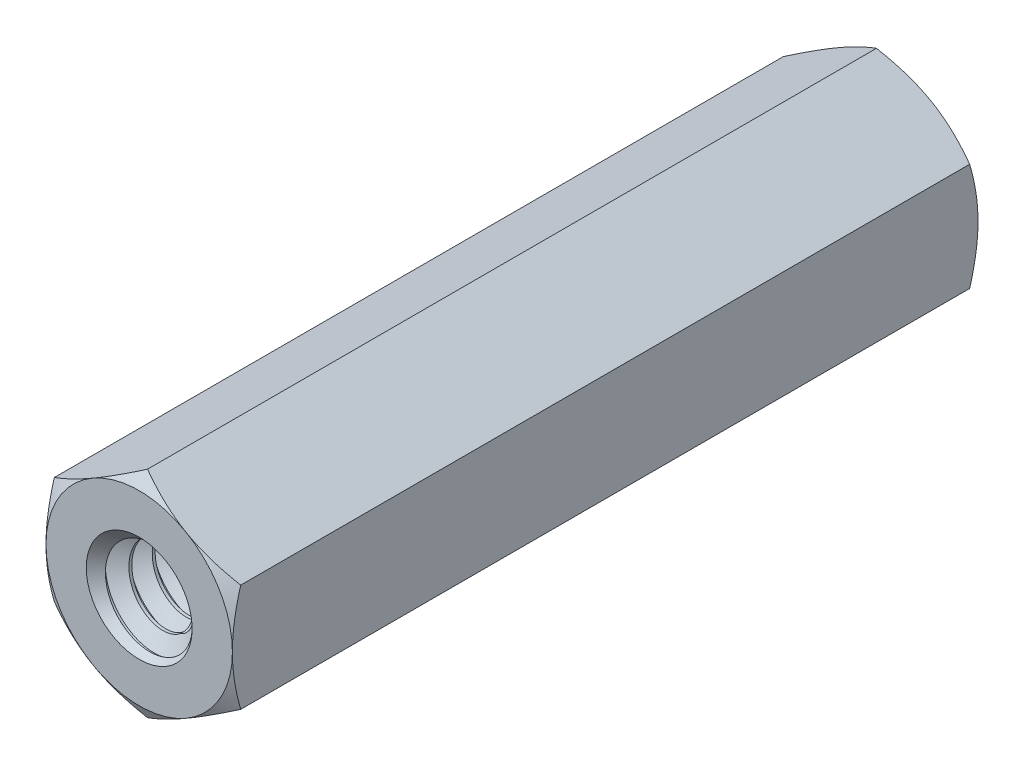
from build123d import *

# Parameters (mm, degrees)
EXTRUDE1_DEPTH          = 12.7
EXTRUDE1_DEPTH_BACK     = 12.7
SKETCH1_R               = 1.7526
SWEEP1_PITCH            = 0.79375
EXTRUDE2_DEPTH          = 27.639126821
SKETCH8_OUTSIDE_W       = 109.682
SKETCH8_OUTSIDE_H       = 110.664
SKETCH8_OUTSIDE_R       = 3.175
EXTRUDE4_DEPTH          = 27.639126821
EXTRUDE4_DRAFT          = -60
MIRROR1_COPY_1_SKETCH_W = 109.682
MIRROR1_COPY_1_SKETCH_H = 110.664
MIRROR1_COPY_1_SKETCH_R = 3.175
MIRROR1_COPY_1_DEPTH    = 27.639126821
MIRROR1_COPY_1_DRAFT    = -60


with BuildPart() as part:
    # Sketch1 → Extrude1 (new, two sides: drawn at the far end of the back side and taken through both)
    with BuildSketch(Plane.XY.offset(-EXTRUDE1_DEPTH_BACK)):
        Polygon((0, 3.666174209), (-3.175, 1.833087105), (-3.175, -1.833087105), (0, -3.666174209), (3.175, -1.833087105), (3.175, 1.833087105), align=None)
        Circle(SKETCH1_R, mode=Mode.SUBTRACT)
    extrude(amount=EXTRUDE1_DEPTH + EXTRUDE1_DEPTH_BACK)

    # Sweep1: arcs per turn and ends read off the stored shape
    # Sweep1: the profile of Sketch12 profile screwed along a right-hand helix through 33 turns, 8 arcs to a turn; built about Z, then put on its axis
    sweep1_z = Axis((0, 0, 0), (0, 0, 1))
    sweep1_corners = [(1.7529, 0, -0.694704455), (1.7529, 0, 0.000173205), (1.237044252, 0, -0.29765625), (1.237044252, 0, -0.396875)]
    with BuildLine(mode=Mode.PRIVATE) as sweep1_profile:
        Line(sweep1_corners[0], sweep1_corners[1])
        Line(sweep1_corners[1], sweep1_corners[2])
        Line(sweep1_corners[2], sweep1_corners[3])
        Line(sweep1_corners[3], sweep1_corners[0])
    sweep1_cap = Face(sweep1_profile.wire())
    sweep1_turn_angles = [0, 22.5, 45, 67.5, 90, 112.5, 135, 157.5, 180, 202.5, 225, 247.5, 270, 292.5, 315, 337.5, 360]
    sweep1_turn_weights = [1, 0.9238795325112867, 1, 0.9238795325112867, 1, 0.9238795325112867, 1, 0.9238795325112867, 1, 0.9238795325112867, 1, 0.9238795325112867, 1, 0.9238795325112867, 1, 0.9238795325112867, 1]
    sweep1_turn_rails = [Edge.make_bspline([Vector(p[0], p[1], 0).rotate(sweep1_z, sweep1_turn_angles[k]) / sweep1_turn_weights[k] + Vector(0, 0, p[2] + SWEEP1_PITCH * sweep1_turn_angles[k] / 360) for k in range(17)], [0, 0, 0, 1, 1, 2, 2, 3, 3, 4, 4, 5, 5, 6, 6, 7, 7, 8, 8, 8], 2, sweep1_turn_weights) for p in sweep1_corners]
    sweep1_turn_sides = [Face.make_surface_from_curves(sweep1_turn_rails[p[0]], sweep1_turn_rails[p[1]]) for p in [(0, 1), (1, 2), (2, 3), (3, 0)]]
    sweep1 = Plane(origin=(0, 0, -12.7), x_dir=(0, 1, 0), z_dir=(0, 0, 1)) * Solid(Shell([*[p.moved(Location((0, 0, SWEEP1_PITCH * i))) for i in range(33) for p in sweep1_turn_sides], sweep1_cap, sweep1_cap.rotate(sweep1_z, 11880).moved(Location((0, 0, SWEEP1_PITCH * 11880 / 360)))]))
    add(sweep1)

    # Sketch6 → Extrude2 (cut, through all)
    with BuildSketch(Plane(origin=(0, 0, -12.7), x_dir=(-1, 0, 0), z_dir=(0, 0, -1))):
        Polygon((0, 3.666174209), (-3.175, 1.833087105), (-3.175, -1.833087105), (0, -3.666174209), (3.175, -1.833087105), (3.175, 1.833087105), align=None)
    extrude2 = extrude(amount=EXTRUDE2_DEPTH, mode=Mode.SUBTRACT)

    # Extrude3 cone 1 section (through the dimple's axis) → Extrude3 (revolve, cut)
    with BuildSketch(Plane(origin=(0, 0, -12.7), x_dir=(0, 1, 0), z_dir=(1, 0, 0))):
        Polygon((0, 0), (1.8034, 0), (0, 1.933909732), align=None)
    extrude3 = revolve(axis=Axis((0, 0, -12.7), (0, 0, 1)), mode=Mode.SUBTRACT)


with BuildPart() as extrude4_tool:
    # Sketch8 outside → Extrude4 (with draft: the straight prism first)
    with BuildSketch(Plane(origin=(0, 0, -12.7), x_dir=(-1, 0, 0), z_dir=(0, 0, -1))):
        Rectangle(SKETCH8_OUTSIDE_W, SKETCH8_OUTSIDE_H)
        Circle(SKETCH8_OUTSIDE_R, mode=Mode.SUBTRACT)
    extrude(amount=-EXTRUDE4_DEPTH)
    # Extrude4: the draft: its side faces are tilted about the plane it starts from
    extrude4_sides = [extrude4_tool.faces().sort_by_distance(p)[0] for p in [
        (0, -55.332, 1.119563411),
        (-54.841, 0, 1.119563411),
        (0, 55.332, 1.119563411),
        (54.841, 0, 1.119563411),
        (3.175, 0, 1.119563411),
    ]]
    draft(extrude4_sides, Plane(origin=(0, 0, -12.7), x_dir=(-1, 0, 0), z_dir=(0, 0, -1)), EXTRUDE4_DRAFT)


with BuildPart() as part_1:
    add(part.part)

    # Extrude4: cut by extrude4_tool
    add(extrude4_tool.part, mode=Mode.SUBTRACT)

    # Mirror1: Extrude2, Extrude3 across plane
    add(extrude2.mirror(Plane.XY), mode=Mode.SUBTRACT)
    add(extrude3.mirror(Plane.XY), mode=Mode.SUBTRACT)


with BuildPart() as mirror1_copy_1_tool:
    # Mirror1 copy 1 sketch → Mirror1 copy 1 (with draft: the straight prism first)
    with BuildSketch(Plane(origin=(0, 0, 12.7), x_dir=(-1, 0, 0), z_dir=(0, 0, 1))):
        Rectangle(MIRROR1_COPY_1_SKETCH_W, MIRROR1_COPY_1_SKETCH_H)
        Circle(MIRROR1_COPY_1_SKETCH_R, mode=Mode.SUBTRACT)
    extrude(amount=-MIRROR1_COPY_1_DEPTH)
    # Mirror1 copy 1: the draft: its side faces are tilted about the plane it starts from
    mirror1_copy_1_sides = [mirror1_copy_1_tool.faces().sort_by_distance(p)[0] for p in [
        (0, -55.332, -1.119563411),
        (-54.841, 0, -1.119563411),
        (0, 55.332, -1.119563411),
        (54.841, 0, -1.119563411),
        (3.175, 0, -1.119563411),
    ]]
    draft(mirror1_copy_1_sides, Plane(origin=(0, 0, 12.7), x_dir=(-1, 0, 0), z_dir=(0, 0, 1)), MIRROR1_COPY_1_DRAFT)


with BuildPart() as part_2:
    add(part_1.part)

    # Mirror1 copy 1: cut by mirror1_copy_1_tool
    add(mirror1_copy_1_tool.part, mode=Mode.SUBTRACT)


solid = part_2.part
